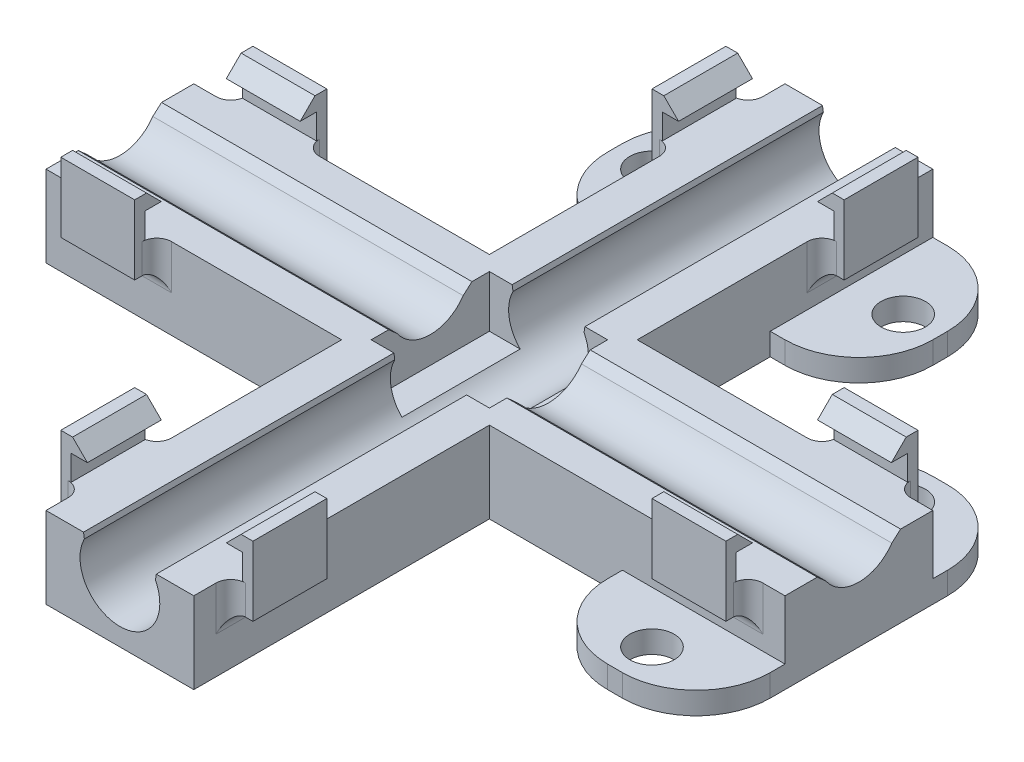
from build123d import *

# Parameters (mm, degrees)
BOSS_EXTRUDE5_DEPTH          = 5.5
CUT_EXTRUDE1_REACH           = 58.172
SKETCH4_R                    = 2.7
SKETCH5_R                    = 2.7
CUT_EXTRUDE2_DEPTH           = 57.171612047
SKETCH6_W                    = 8
SKETCH6_H                    = 8
CUT_EXTRUDE3_DEPTH           = 3.5
SKETCH7_W                    = 5
SKETCH7_H                    = 4.7
BOSS_EXTRUDE6_DEPTH          = 1.5
SKETCH8_W                    = 5
SKETCH8_H                    = 1
BOSS_EXTRUDE7_DEPTH          = 0.3
CHAMFER1_SIZE                = 1
CHAMFER1_OF_MIRROR2_SIZE     = 1
FILLET2_R                    = 1
SKETCH13_W                   = 5
SKETCH13_H                   = 1.7
CUT_EXTRUDE6_DEPTH           = 0.8
SKETCH9_W                    = 11
SKETCH9_H                    = 1.5
BOSS_EXTRUDE8_DEPTH          = 6
CUT_EXTRUDE5_REACH           = 38.294
SKETCH11_R                   = 1.5
CIRPATTERN12_COUNT           = 2
CIRPATTERN12_ANGLE           = 90
CIRPATTERN12_COPY_1_SKETCH_W = 11
CIRPATTERN12_COPY_1_SKETCH_H = 1.5
CIRPATTERN12_COPY_1_DEPTH    = 6
CIRPATTERN12_COPY_2_REACH    = 38.294
CIRPATTERN12_COPY_2_SKETCH_R = 1.5
FILLET4_R                    = 5
CIRPATTERN14_COUNT           = 4
CIRPATTERN14_COPY_1_SKETCH_W = 5
CIRPATTERN14_COPY_1_SKETCH_H = 1.7
CIRPATTERN14_COPY_1_DEPTH    = 0.8
CIRPATTERN14_COPY_2_SKETCH_W = 5
CIRPATTERN14_COPY_2_SKETCH_H = 1.7
CIRPATTERN14_COPY_2_DEPTH    = 0.8
CIRPATTERN14_COPY_3_SKETCH_W = 5
CIRPATTERN14_COPY_3_SKETCH_H = 1.7
CIRPATTERN14_COPY_3_DEPTH    = 0.8
CHAMFER2_START               = -26
CHAMFER2_DEPTH               = 52
CHAMFER2_2_DEPTH             = 52


with BuildPart() as part:
    # Sketch3 → Boss-Extrude5 (new body)
    with BuildSketch(Plane(origin=(0, 0, 0), x_dir=(1, 0, 0), z_dir=(0, 1, 0))):
        Polygon((5, 5), (25, 5), (25, -5), (5, -5), (5, -25), (-5, -25), (-5, -5), (-25, -5), (-25, 5), (-5, 5), (-5, 25), (5, 25), align=None)
    extrude(amount=BOSS_EXTRUDE5_DEPTH)

    # Sketch4 → Cut-Extrude1 (cut, up to next)
    with BuildSketch(Plane.XY.offset(25), mode=Mode.PRIVATE) as cut_extrude1_sk1:
        with Locations((0, 3.9)):
            Circle(SKETCH4_R)
    cut_extrude1_tool1 = extrude(cut_extrude1_sk1.sketch, amount=-CUT_EXTRUDE1_REACH, mode=Mode.PRIVATE) & part.part
    add(cut_extrude1_tool1.solids().sort_by_distance((0, 3.9, 25))[0], mode=Mode.SUBTRACT)

    # Sketch5 → Cut-Extrude2 (cut, through all)
    with BuildSketch(Plane(origin=(25, 0, 0), x_dir=(0, 0, -1), z_dir=(1, 0, 0))):
        with Locations((0, 6.5)):
            Circle(SKETCH5_R)
    extrude(amount=-CUT_EXTRUDE2_DEPTH, mode=Mode.SUBTRACT)

    # Sketch6 → Cut-Extrude3 (cut)
    with BuildSketch(Plane(origin=(0, 5.5, 0), x_dir=(1, 0, 0), z_dir=(0, 1, 0))):
        Rectangle(SKETCH6_W, SKETCH6_H)
    extrude(amount=-CUT_EXTRUDE3_DEPTH, mode=Mode.SUBTRACT)

    # Sketch7 → Boss-Extrude6 (add)
    with BuildSketch(Plane(origin=(5, 0, 0), x_dir=(0, 0, -1), z_dir=(1, 0, 0))):
        with Locations((-20, 5.85)):
            Rectangle(SKETCH7_W, SKETCH7_H)
    boss_extrude6 = extrude(amount=BOSS_EXTRUDE6_DEPTH)

    # Sketch8 → Boss-Extrude7 (add)
    with BuildSketch(Plane.ZY.offset(-5)):
        with Locations((20, 7.7)):
            Rectangle(SKETCH8_W, SKETCH8_H)
    boss_extrude7 = extrude(amount=BOSS_EXTRUDE7_DEPTH)

    # Chamfer1
    chamfer1_edges = [part.edges().sort_by_distance(p)[0] for p in [
        (4.7, 8.2, 20),
    ]]
    chamfer(chamfer1_edges, length=CHAMFER1_SIZE - 0.0001)  # a hair under: the kernel refuses the full size

    # Mirror2: Boss-Extrude6, Boss-Extrude7 across plane
    add(boss_extrude6.mirror(Plane(origin=(0, 0, 0), x_dir=(0, 0, 1), z_dir=(1, 0, 0))))
    add(boss_extrude7.mirror(Plane(origin=(0, 0, 0), x_dir=(0, 0, 1), z_dir=(1, 0, 0))))

    # Chamfer1 of Mirror2
    chamfer1_of_mirror2_edges = [part.edges().sort_by_distance(p)[0] for p in [
        (-4.7, 8.2, 20),
    ]]
    chamfer(chamfer1_of_mirror2_edges, length=CHAMFER1_OF_MIRROR2_SIZE - 0.0001)  # a hair under: the kernel refuses the full size

    # CirPattern6: read off the stored shape, not the designer's step
    # CirPattern6: loft between two sections, ruled curve by curve
    cirpattern6_from = [
        Edge.make_line((-17.5, 7.2, 5), (-17.5, 5.5, 5)),
        Edge.make_line((-17.5, 8.2, 6.5), (-17.5, 8.2, 5.7)),
        Edge.make_line((-17.5, 3.5, 5), (-17.5, 3.5, 6.5)),
        Edge.make_line((-17.5, 7.2, 5), (-17.5, 7.2, 4.7)),
        Edge.make_line((-17.5, 3.5, 6.5), (-17.5, 8.2, 6.5)),
        Edge.make_line((-17.5, 8.2, 5.7), (-17.5, 7.2, 4.7)),
        Edge.make_line((-17.5, 3.5, 5), (-17.5, 5.5, 5)),
    ]
    cirpattern6_to = [
        Edge.make_line((-22.5, 7.2, 5), (-22.5, 5.5, 5)),
        Edge.make_line((-22.5, 8.2, 6.5), (-22.5, 8.2, 5.7)),
        Edge.make_line((-22.5, 3.5, 5), (-22.5, 3.5, 6.5)),
        Edge.make_line((-22.5, 7.2, 5), (-22.5, 7.2, 4.7)),
        Edge.make_line((-22.5, 3.5, 6.5), (-22.5, 8.2, 6.5)),
        Edge.make_line((-22.5, 8.2, 5.7), (-22.5, 7.2, 4.7)),
        Edge.make_line((-22.5, 3.5, 5), (-22.5, 5.5, 5)),
    ]
    cirpattern6 = Solid(Shell([*[Face.make_surface_from_curves(cirpattern6_from[k], cirpattern6_to[k]) for k in range(7)], Face(Wire(cirpattern6_from)), Face(Wire(cirpattern6_to))]))
    add(cirpattern6)

    # CirPattern6 2: loft between two sections, ruled curve by curve
    cirpattern6_2_from = [
        Edge.make_line((22.5, 5.5, 5), (22.5, 7.2, 5)),
        Edge.make_line((22.5, 8.2, 6.5), (22.5, 8.2, 5.7)),
        Edge.make_line((22.5, 3.5, 5), (22.5, 3.5, 6.5)),
        Edge.make_line((22.5, 7.2, 5), (22.5, 7.2, 4.7)),
        Edge.make_line((22.5, 3.5, 6.5), (22.5, 8.2, 6.5)),
        Edge.make_line((22.5, 7.2, 4.7), (22.5, 8.2, 5.7)),
        Edge.make_line((22.5, 3.5, 5), (22.5, 5.5, 5)),
    ]
    cirpattern6_2_to = [
        Edge.make_line((17.5, 5.5, 5), (17.5, 7.2, 5)),
        Edge.make_line((17.5, 8.2, 6.5), (17.5, 8.2, 5.7)),
        Edge.make_line((17.5, 3.5, 5), (17.5, 3.5, 6.5)),
        Edge.make_line((17.5, 7.2, 5), (17.5, 7.2, 4.7)),
        Edge.make_line((17.5, 3.5, 6.5), (17.5, 8.2, 6.5)),
        Edge.make_line((17.5, 7.2, 4.7), (17.5, 8.2, 5.7)),
        Edge.make_line((17.5, 3.5, 5), (17.5, 5.5, 5)),
    ]
    cirpattern6_2 = Solid(Shell([*[Face.make_surface_from_curves(cirpattern6_2_from[k], cirpattern6_2_to[k]) for k in range(7)], Face(Wire(cirpattern6_2_from)), Face(Wire(cirpattern6_2_to))]))
    add(cirpattern6_2)

    # CirPattern6 3: loft between two sections, ruled curve by curve
    cirpattern6_3_from = [
        Edge.make_line((-5, 7.2, -22.5), (-5, 5.5, -22.5)),
        Edge.make_line((-5.7, 8.2, -22.5), (-6.5, 8.2, -22.5)),
        Edge.make_line((-5, 3.5, -22.5), (-6.5, 3.5, -22.5)),
        Edge.make_line((-5, 7.2, -22.5), (-4.7, 7.2, -22.5)),
        Edge.make_line((-6.5, 8.2, -22.5), (-6.5, 3.5, -22.5)),
        Edge.make_line((-4.7, 7.2, -22.5), (-5.7, 8.2, -22.5)),
        Edge.make_line((-5, 3.5, -22.5), (-5, 5.5, -22.5)),
    ]
    cirpattern6_3_to = [
        Edge.make_line((-5, 7.2, -17.5), (-5, 5.5, -17.5)),
        Edge.make_line((-5.7, 8.2, -17.5), (-6.5, 8.2, -17.5)),
        Edge.make_line((-5, 3.5, -17.5), (-6.5, 3.5, -17.5)),
        Edge.make_line((-5, 7.2, -17.5), (-4.7, 7.2, -17.5)),
        Edge.make_line((-6.5, 8.2, -17.5), (-6.5, 3.5, -17.5)),
        Edge.make_line((-4.7, 7.2, -17.5), (-5.7, 8.2, -17.5)),
        Edge.make_line((-5, 3.5, -17.5), (-5, 5.5, -17.5)),
    ]
    cirpattern6_3 = Solid(Shell([*[Face.make_surface_from_curves(cirpattern6_3_from[k], cirpattern6_3_to[k]) for k in range(7)], Face(Wire(cirpattern6_3_from)), Face(Wire(cirpattern6_3_to))]))
    add(cirpattern6_3)

    # CirPattern6 4: loft between two sections, ruled curve by curve
    cirpattern6_4_from = [
        Edge.make_line((22.5, 7.2, -5), (22.5, 5.5, -5)),
        Edge.make_line((22.5, 8.2, -5.7), (22.5, 8.2, -6.5)),
        Edge.make_line((22.5, 3.5, -5), (22.5, 3.5, -6.5)),
        Edge.make_line((22.5, 7.2, -5), (22.5, 7.2, -4.7)),
        Edge.make_line((22.5, 8.2, -6.5), (22.5, 3.5, -6.5)),
        Edge.make_line((22.5, 7.2, -4.7), (22.5, 8.2, -5.7)),
        Edge.make_line((22.5, 3.5, -5), (22.5, 5.5, -5)),
    ]
    cirpattern6_4_to = [
        Edge.make_line((17.5, 7.2, -5), (17.5, 5.5, -5)),
        Edge.make_line((17.5, 8.2, -5.7), (17.5, 8.2, -6.5)),
        Edge.make_line((17.5, 3.5, -5), (17.5, 3.5, -6.5)),
        Edge.make_line((17.5, 7.2, -5), (17.5, 7.2, -4.7)),
        Edge.make_line((17.5, 8.2, -6.5), (17.5, 3.5, -6.5)),
        Edge.make_line((17.5, 7.2, -4.7), (17.5, 8.2, -5.7)),
        Edge.make_line((17.5, 3.5, -5), (17.5, 5.5, -5)),
    ]
    cirpattern6_4 = Solid(Shell([*[Face.make_surface_from_curves(cirpattern6_4_from[k], cirpattern6_4_to[k]) for k in range(7)], Face(Wire(cirpattern6_4_from)), Face(Wire(cirpattern6_4_to))]))
    add(cirpattern6_4)

    # CirPattern6 5: loft between two sections, ruled curve by curve
    cirpattern6_5_from = [
        Edge.make_line((-17.5, 5.5, -5), (-17.5, 7.2, -5)),
        Edge.make_line((-17.5, 8.2, -6.5), (-17.5, 8.2, -5.7)),
        Edge.make_line((-17.5, 3.5, -5), (-17.5, 3.5, -6.5)),
        Edge.make_line((-17.5, 7.2, -5), (-17.5, 7.2, -4.7)),
        Edge.make_line((-17.5, 3.5, -6.5), (-17.5, 8.2, -6.5)),
        Edge.make_line((-17.5, 7.2, -4.7), (-17.5, 8.2, -5.7)),
        Edge.make_line((-17.5, 3.5, -5), (-17.5, 5.5, -5)),
    ]
    cirpattern6_5_to = [
        Edge.make_line((-22.5, 5.5, -5), (-22.5, 7.2, -5)),
        Edge.make_line((-22.5, 8.2, -6.5), (-22.5, 8.2, -5.7)),
        Edge.make_line((-22.5, 3.5, -5), (-22.5, 3.5, -6.5)),
        Edge.make_line((-22.5, 7.2, -5), (-22.5, 7.2, -4.7)),
        Edge.make_line((-22.5, 3.5, -6.5), (-22.5, 8.2, -6.5)),
        Edge.make_line((-22.5, 7.2, -4.7), (-22.5, 8.2, -5.7)),
        Edge.make_line((-22.5, 3.5, -5), (-22.5, 5.5, -5)),
    ]
    cirpattern6_5 = Solid(Shell([*[Face.make_surface_from_curves(cirpattern6_5_from[k], cirpattern6_5_to[k]) for k in range(7)], Face(Wire(cirpattern6_5_from)), Face(Wire(cirpattern6_5_to))]))
    add(cirpattern6_5)

    # CirPattern6 6: loft between two sections, ruled curve by curve
    cirpattern6_6_from = [
        Edge.make_line((5, 5.5, -22.5), (5, 7.2, -22.5)),
        Edge.make_line((6.5, 8.2, -22.5), (5.7, 8.2, -22.5)),
        Edge.make_line((5, 3.5, -22.5), (6.5, 3.5, -22.5)),
        Edge.make_line((6.5, 3.5, -22.5), (6.5, 8.2, -22.5)),
        Edge.make_line((5, 7.2, -22.5), (4.7, 7.2, -22.5)),
        Edge.make_line((4.7, 7.2, -22.5), (5.7, 8.2, -22.5)),
        Edge.make_line((5, 3.5, -22.5), (5, 5.5, -22.5)),
    ]
    cirpattern6_6_to = [
        Edge.make_line((5, 5.5, -17.5), (5, 7.2, -17.5)),
        Edge.make_line((6.5, 8.2, -17.5), (5.7, 8.2, -17.5)),
        Edge.make_line((5, 3.5, -17.5), (6.5, 3.5, -17.5)),
        Edge.make_line((6.5, 3.5, -17.5), (6.5, 8.2, -17.5)),
        Edge.make_line((5, 7.2, -17.5), (4.7, 7.2, -17.5)),
        Edge.make_line((4.7, 7.2, -17.5), (5.7, 8.2, -17.5)),
        Edge.make_line((5, 3.5, -17.5), (5, 5.5, -17.5)),
    ]
    cirpattern6_6 = Solid(Shell([*[Face.make_surface_from_curves(cirpattern6_6_from[k], cirpattern6_6_to[k]) for k in range(7)], Face(Wire(cirpattern6_6_from)), Face(Wire(cirpattern6_6_to))]))
    add(cirpattern6_6)

    # Fillet2
    fillet2_edges = [part.edges().sort_by_distance(p)[0] for p in [
        (5, 3.5, 20),
        (-5, 4.5, 22.5),
        (-5, 4.5, 17.5),
        (-5, 3.5, 20),
        (22.5, 4.5, 5),
        (17.5, 4.5, 5),
        (20, 3.5, 5),
        (5, 4.5, -17.5),
        (5, 4.5, -22.5),
        (5, 3.5, -20),
        (-22.5, 4.5, -5),
        (-17.5, 4.5, -5),
        (-20, 3.5, -5),
        (17.5, 4.5, -5),
        (22.5, 4.5, -5),
        (20, 3.5, -5),
        (-5, 4.5, -22.5),
        (-5, 4.5, -17.5),
        (-5, 3.5, -20),
        (-22.5, 4.5, 5),
        (-17.5, 4.5, 5),
        (-20, 3.5, 5),
        (5, 4.5, 22.5),
        (5, 4.5, 17.5),
    ]]
    fillet(fillet2_edges, radius=FILLET2_R)

    # Sketch13 → Cut-Extrude6 (cut)
    with BuildSketch(Plane.ZY.offset(-5)):
        with Locations((20, 6.35)):
            Rectangle(SKETCH13_W, SKETCH13_H)
    cut_extrude6 = extrude(amount=-CUT_EXTRUDE6_DEPTH, mode=Mode.SUBTRACT)

    # Sketch9 → Boss-Extrude8 (add)
    with BuildSketch(Plane(origin=(0, 0, -5), x_dir=(-1, 0, 0), z_dir=(0, 0, -1))):
        with Locations((-19.5, 0.75)):
            Rectangle(SKETCH9_W, SKETCH9_H)
    boss_extrude8 = extrude(amount=BOSS_EXTRUDE8_DEPTH)

    # Sketch11 → Cut-Extrude5 (cut, up to next)
    with BuildSketch(Plane.XZ, mode=Mode.PRIVATE) as cut_extrude5_sk1:
        with Locations(Location((19.5, -8.5, 0), (0, 0, 270))):
            Circle(SKETCH11_R)
    cut_extrude5_tool1 = extrude(cut_extrude5_sk1.sketch, amount=-CUT_EXTRUDE5_REACH, mode=Mode.PRIVATE) & part.part
    cut_extrude5 = cut_extrude5_tool1.solids().sort_by_distance((19.5, 0, -8.5))[0]
    add(cut_extrude5, mode=Mode.SUBTRACT)

    # Mirror3: Boss-Extrude8, Cut-Extrude5 across plane
    add(boss_extrude8.mirror(Plane.XY))
    add(cut_extrude5.mirror(Plane.XY), mode=Mode.SUBTRACT)

    # CirPattern12: Boss-Extrude8, Cut-Extrude5 ×2 about axis
    cirpattern12_axis = Axis((0, 0, 0), (0, 1, 0))
    add([boss_extrude8.rotate(cirpattern12_axis, i * CIRPATTERN12_ANGLE / (CIRPATTERN12_COUNT - 1)) for i in range(1, CIRPATTERN12_COUNT)])
    add([cut_extrude5.rotate(cirpattern12_axis, i * CIRPATTERN12_ANGLE / (CIRPATTERN12_COUNT - 1)) for i in range(1, CIRPATTERN12_COUNT)], mode=Mode.SUBTRACT)

    # CirPattern12 copy 1 sketch → CirPattern12 copy 1 (add)
    with BuildSketch(Plane(origin=(5, 0, 0), x_dir=(0, 0, 1), z_dir=(1, 0, 0))):
        with Locations((-19.5, -0.75)):
            Rectangle(CIRPATTERN12_COPY_1_SKETCH_W, CIRPATTERN12_COPY_1_SKETCH_H)
    extrude(amount=CIRPATTERN12_COPY_1_DEPTH)

    # CirPattern12 copy 2 sketch → CirPattern12 copy 2 (cut, up to next)
    with BuildSketch(Plane(origin=(0, 0, 0), x_dir=(0, 0, -1), z_dir=(0, -1, 0)), mode=Mode.PRIVATE) as cirpattern12_copy_2_sk1:
        with Locations((19.5, 8.5)):
            Circle(CIRPATTERN12_COPY_2_SKETCH_R)
    cirpattern12_copy_2_tool1 = extrude(cirpattern12_copy_2_sk1.sketch, amount=-CIRPATTERN12_COPY_2_REACH, mode=Mode.PRIVATE) & part.part
    add(cirpattern12_copy_2_tool1.solids().sort_by_distance((8.5, 0, -19.5))[0], mode=Mode.SUBTRACT)

    # Fillet4
    fillet4_edges = [part.edges().sort_by_distance(p)[0] for p in [
        (14, 0.75, -11),
        (25, 0.75, -11),
        (14, 0.75, 11),
        (25, 0.75, 11),
        (11, 0.75, -14),
        (11, 0.75, -25),
        (-11, 0.75, -14),
        (-11, 0.75, -25),
    ]]
    fillet(fillet4_edges, radius=FILLET4_R)

    # Mirror4: Cut-Extrude6 across plane
    add(cut_extrude6.mirror(Plane(origin=(0, 0, 0), x_dir=(0, 0, 1), z_dir=(1, 0, 0))), mode=Mode.SUBTRACT)

    # CirPattern14: Cut-Extrude6 ×4 about axis
    cirpattern14_axis = Axis((0, 0, 0), (0, 1, 0))
    for i in range(1, CIRPATTERN14_COUNT):
        add(cut_extrude6.rotate(cirpattern14_axis, i * 360 / CIRPATTERN14_COUNT), mode=Mode.SUBTRACT)

    # CirPattern14 copy 1 sketch → CirPattern14 copy 1 (cut)
    with BuildSketch(Plane(origin=(0, 0, 5), x_dir=(1, 0, 0), z_dir=(0, 0, -1))):
        with Locations((20, -6.35)):
            Rectangle(CIRPATTERN14_COPY_1_SKETCH_W, CIRPATTERN14_COPY_1_SKETCH_H)
    extrude(amount=-CIRPATTERN14_COPY_1_DEPTH, mode=Mode.SUBTRACT)

    # CirPattern14 copy 2 sketch → CirPattern14 copy 2 (cut)
    with BuildSketch(Plane(origin=(5, 0, 0), x_dir=(0, 0, -1), z_dir=(-1, 0, 0))):
        with Locations((20, -6.35)):
            Rectangle(CIRPATTERN14_COPY_2_SKETCH_W, CIRPATTERN14_COPY_2_SKETCH_H)
    extrude(amount=-CIRPATTERN14_COPY_2_DEPTH, mode=Mode.SUBTRACT)

    # CirPattern14 copy 3 sketch → CirPattern14 copy 3 (cut)
    with BuildSketch(Plane(origin=(0, 0, -5), x_dir=(-1, 0, 0), z_dir=(0, 0, 1))):
        with Locations((20, -6.35)):
            Rectangle(CIRPATTERN14_COPY_3_SKETCH_W, CIRPATTERN14_COPY_3_SKETCH_H)
    extrude(amount=-CIRPATTERN14_COPY_3_DEPTH, mode=Mode.SUBTRACT)

    # Chamfer2: read off the stored shape, not the designer's step
    # Chamfer2 outline → Chamfer2 (cut)
    with BuildSketch(Plane.YZ.offset(CHAMFER2_START)):
        with BuildLine():
            Line((5.5, 2.507987241), (5.5, 2.818415652))
            Line((5.5, 2.818415652), (4.974212995, 2.227548881))
            ThreePointArc((4.974212995, 2.227548881), (5.229346067, 2.382317902), (5.5, 2.507987241))
        make_face()
        with BuildLine():
            ThreePointArc((5.5, -2.507987241), (5.229346067, -2.382317902), (4.974212995, -2.227548881))
            Line((4.974212995, -2.227548881), (5.5, -2.818415652))
            Line((5.5, -2.818415652), (5.5, -2.507987241))
        make_face()
    extrude(amount=CHAMFER2_DEPTH, mode=Mode.SUBTRACT)

    # Chamfer2 2 outline → Chamfer2 2 (cut)
    with BuildSketch(Plane.XY.offset(CHAMFER2_START)):
        with BuildLine():
            ThreePointArc((2.174856317, 5.5), (2.297140225, 5.31885404), (2.404372283, 5.128411138))
            Line((2.404372283, 5.128411138), (2.460959922, 5.5))
            Line((2.460959922, 5.5), (2.174856317, 5.5))
        make_face()
        with BuildLine():
            Line((-2.460959922, 5.5), (-2.404372283, 5.128411138))
            ThreePointArc((-2.404372283, 5.128411138), (-2.297140225, 5.31885404), (-2.174856317, 5.5))
            Line((-2.174856317, 5.5), (-2.460959922, 5.5))
        make_face()
    extrude(amount=CHAMFER2_2_DEPTH, mode=Mode.SUBTRACT)


solid = part.part
